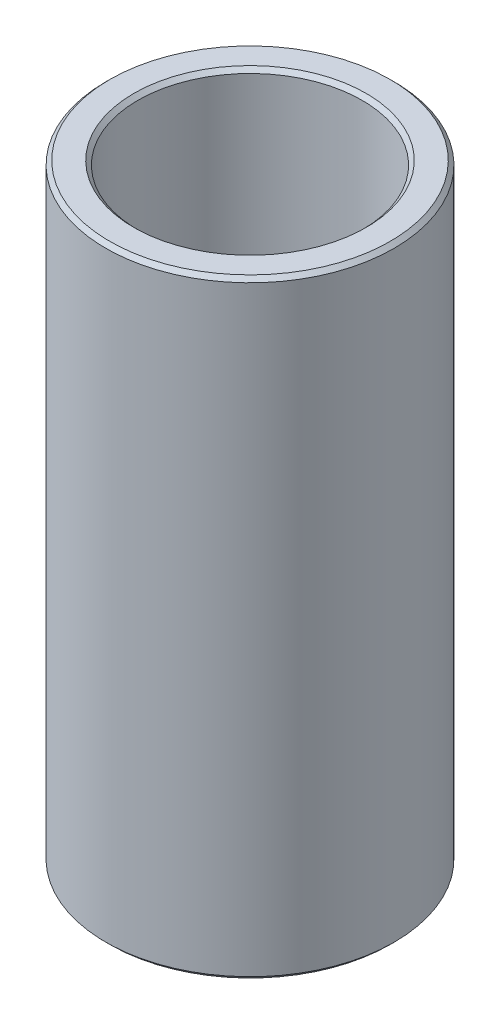
from build123d import *

# Parameters (mm, degrees)
CHAMFER1_SIZE = 0.25


with BuildPart() as part:
    # Sketch1 → Revolve1 (revolve)
    with BuildSketch(Plane.XY):
        Polygon((2, 0), (2, 1), (5, 4), (7, 4), (7, 38), (9, 38), (9, 0), align=None)
    revolve(axis=Axis((0, -587.15114798, 0), (0, 1, 0)))

    # Chamfer1
    chamfer1_edges = [part.edges().sort_by_distance(p)[0] for p in [
        (-9, 38, 0),
        (-7, 38, 0),
        (-9, 0, 0),
        (-2, 0, 0),
    ]]
    chamfer(chamfer1_edges, length=CHAMFER1_SIZE)


solid = part.part
